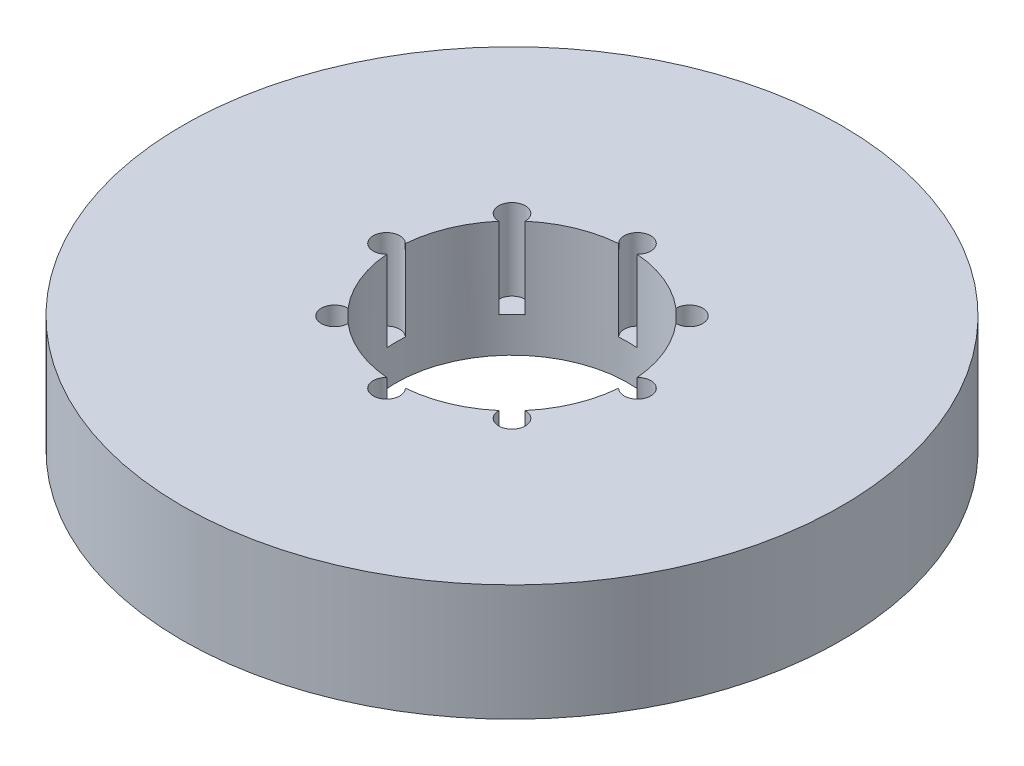
from build123d import *

# Parameters (mm, degrees)
SKETCH1_R           = 85
BOSS_EXTRUDE1_DEPTH = 30
SKETCH2_R           = 30
CUT_EXTRUDE1_DEPTH  = 124.895116934
SKETCH3_R           = 3.431458506
CUT_EXTRUDE2_DEPTH  = 20.906404777
CIRPATTERN1_COUNT   = 8


with BuildPart() as part:
    # Sketch1 → Boss-Extrude1 (new body)
    with BuildSketch(Plane(origin=(0, 0, 0), x_dir=(1, 0, 0), z_dir=(0, 1, 0))):
        Circle(SKETCH1_R)
    extrude(amount=BOSS_EXTRUDE1_DEPTH)

    # Sketch2 → Cut-Extrude1 (cut, through all)
    with BuildSketch(Plane(origin=(0, 0, 0), x_dir=(1, 0, 0), z_dir=(0, 1, 0))):
        Circle(SKETCH2_R)
    extrude(amount=CUT_EXTRUDE1_DEPTH, mode=Mode.SUBTRACT)

    # Sketch3 → Cut-Extrude2 (cut)
    with BuildSketch(Plane(origin=(0, 30, 0), x_dir=(1, 0, 0), z_dir=(0, 1, 0))):
        with Locations((-32.364540133, 0)):
            Circle(SKETCH3_R)
    cut_extrude2 = extrude(amount=-CUT_EXTRUDE2_DEPTH, mode=Mode.SUBTRACT)

    # CirPattern1: Cut-Extrude2 ×8 about axis
    cirpattern1_axis = Axis((0, 0, 0), (0, 1, 0))
    for i in range(1, CIRPATTERN1_COUNT):
        add(cut_extrude2.rotate(cirpattern1_axis, i * 360 / CIRPATTERN1_COUNT), mode=Mode.SUBTRACT)


solid = part.part
